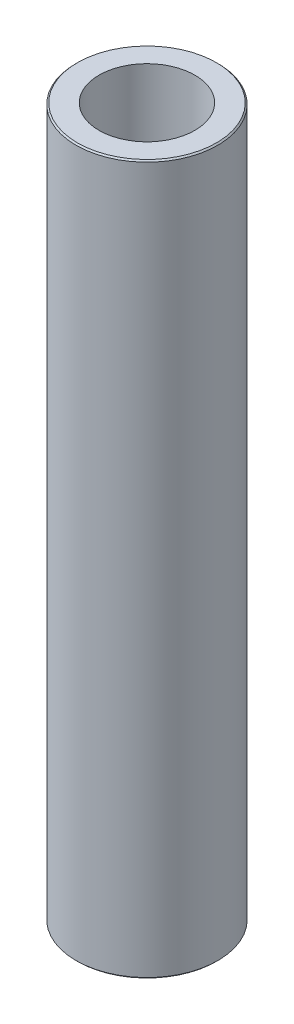
from build123d import *

# Parameters (mm, degrees)
SKETCH1_R           = 60
BOSS_EXTRUDE1_DEPTH = 600
SKETCH2_R           = 40.550433946
CUT_EXTRUDE1_DEPTH  = 606.970296302
CHAMFER1_SIZE       = 1.16749405


with BuildPart() as part:
    # Sketch1 → Boss-Extrude1 (new body)
    with BuildSketch(Plane(origin=(0, 0, 0), x_dir=(1, 0, 0), z_dir=(0, 1, 0))):
        Circle(SKETCH1_R)
    extrude(amount=BOSS_EXTRUDE1_DEPTH)

    # Sketch2 → Cut-Extrude1 (cut, through all)
    with BuildSketch(Plane(origin=(0, 0, 0), x_dir=(1, 0, 0), z_dir=(0, 1, 0))):
        Circle(SKETCH2_R)
    extrude(amount=CUT_EXTRUDE1_DEPTH, mode=Mode.SUBTRACT)

    # Chamfer1
    chamfer1_edges = [part.edges().sort_by_distance(p)[0] for p in [
        (-60, 600, 0),
        (-60, 0, 0),
    ]]
    chamfer(chamfer1_edges, length=CHAMFER1_SIZE)


solid = part.part
